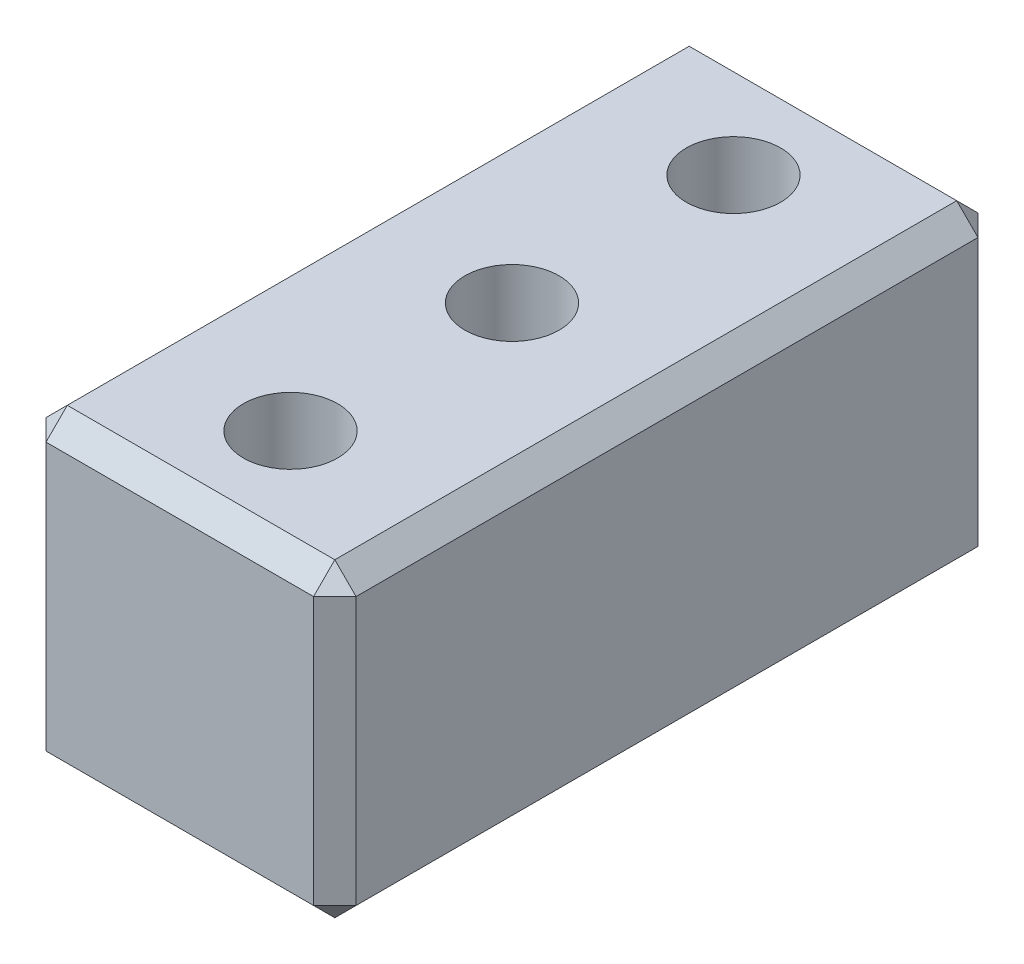
from build123d import *

# Parameters (mm, degrees)
SKETCH1_W               = 22.225
SKETCH1_H               = 22.225
BOSS_EXTRUDE1_DEPTH     = 23.8125
F_1_4_CLEARANCE_HOLE1_D = 6.7564
CHAMFER1_SIZE           = 1.524


with BuildPart() as part:
    # Sketch1 → Boss-Extrude1 (new, symmetric)
    with BuildSketch(Plane.XY):
        Rectangle(SKETCH1_W, SKETCH1_H)
    extrude(amount=BOSS_EXTRUDE1_DEPTH, both=True)

    # 1/4 Clearance Hole1 (through all)
    with Locations(Plane(origin=(0, 11.1125, 0), x_dir=(1, 0, 0), z_dir=(0, 1, 0))):
        with Locations((0, 15.875), (0, -15.875), (0, 0)):
            Hole(F_1_4_CLEARANCE_HOLE1_D / 2)

    # Chamfer1
    chamfer1_edges = [part.edges().sort_by_distance(p)[0] for p in [
        (-11.1125, 11.1125, 0),
        (-11.1125, 0, 23.8125),
        (-11.1125, -11.1125, 0),
        (-11.1125, 0, -23.8125),
        (0, 11.1125, -23.8125),
        (11.1125, 0, -23.8125),
        (0, -11.1125, -23.8125),
        (11.1125, -11.1125, 0),
        (0, -11.1125, 23.8125),
        (11.1125, 0, 23.8125),
        (0, 11.1125, 23.8125),
        (11.1125, 11.1125, 0),
    ]]
    chamfer(chamfer1_edges, length=CHAMFER1_SIZE)


solid = part.part
